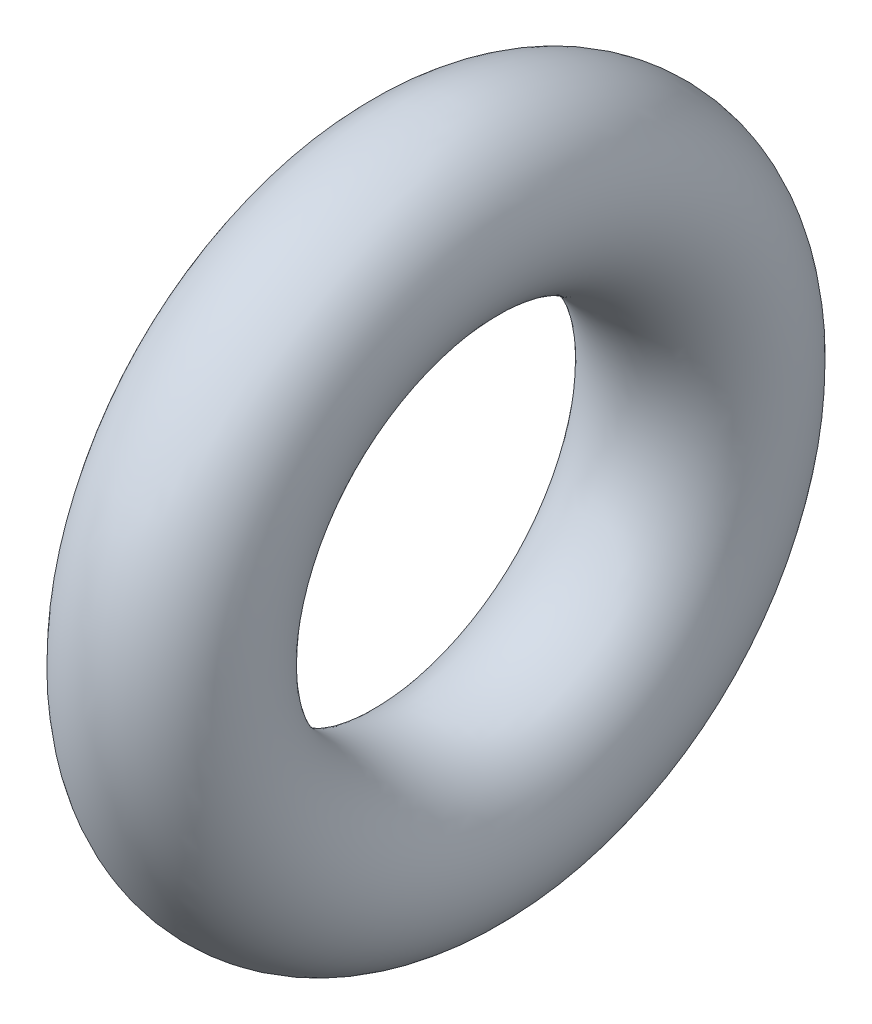
from build123d import *

# Parameters (mm, degrees)
SKETCH1_R = 7.95


with BuildPart() as part:
    # Sketch1 → Revolve1 (revolve)
    with BuildSketch(Plane.XY):
        with Locations((0, 23.8)):
            Circle(SKETCH1_R)
    revolve(axis=Axis((-9.617945587, 0, 0), (1, 0, 0)))


solid = part.part
